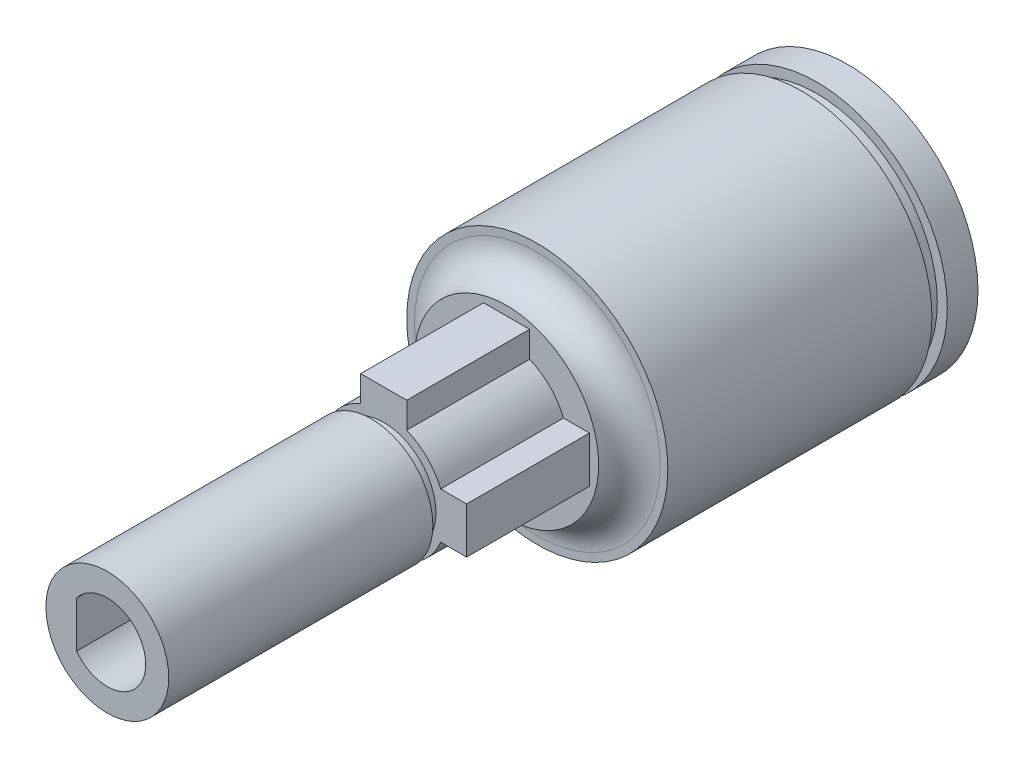
from build123d import *

# Parameters (mm, degrees)
EXTRUDE_1_DEPTH      = 25
EXTRUDE_1_DEPTH_BACK = 1
SKETCH_1_R           = 4
EXTRUDE_2_DEPTH      = 7
EXTRUDE_2_DEPTH_BACK = 1
SKETCH_2_R           = 2.5
EXTRUDE_3_DEPTH      = 2
EXTRUDE_START        = 2
SKETCH_2_3_R         = 6
SKETCH_2_3_R_2       = 2.5
EXTRUDE_4_DEPTH      = 2
SKETCH_4_W           = 0.8
SKETCH_4_H           = 0.6
SKETCH_5_R           = 8.5
EXTRUDE_5_DEPTH      = 20.2
SKETCH_6_W           = 1
SKETCH_6_H           = 0.65
FILLET_2_R           = 2


with BuildPart() as part:
    # 草图1 → 凸台-拉伸1 (new, two sides: drawn at the far end of the back side and taken through both)
    with BuildSketch(Plane.XY.offset(-EXTRUDE_1_DEPTH_BACK)):
        Circle(SKETCH_1_R)
        with BuildLine():
            Line((-2, -1.5), (-2, 1.5))
            ThreePointArc((-2, 1.5), (2.5, 0), (-2, -1.5))
        make_face(mode=Mode.SUBTRACT)
    extrude(amount=EXTRUDE_1_DEPTH + EXTRUDE_1_DEPTH_BACK)

    # 草图1<3> → 凸台-拉伸2 (add, two sides: drawn at the far end of the back side and taken through both)
    with BuildSketch(Plane.XY.offset(-EXTRUDE_2_DEPTH_BACK)):
        with BuildLine():
            Line((-1.5, 5.4), (-1.5, 3.708099244))
            ThreePointArc((-1.5, 3.708099244), (0, 4), (1.5, 3.708099244))
            Line((1.5, 3.708099244), (1.5, 5.4))
            Line((1.5, 5.4), (-1.5, 5.4))
        make_face()
        with BuildLine():
            Line((5.4, 1.5), (3.708099244, 1.5))
            ThreePointArc((3.708099244, 1.5), (4, 0), (3.708099244, -1.5))
            Line((3.708099244, -1.5), (5.4, -1.5))
            Line((5.4, -1.5), (5.4, 1.5))
        make_face()
    extrude(amount=EXTRUDE_2_DEPTH + EXTRUDE_2_DEPTH_BACK)

    # 草图2 → 凸台-拉伸3 (add)
    with BuildSketch(Plane(origin=(0, 0, -1), x_dir=(-1, 0, 0), z_dir=(0, 0, -1))):
        Circle(SKETCH_2_R)
    extrude(amount=-EXTRUDE_3_DEPTH)

    # 草图2<3> → 凸台-拉伸4 (add)
    # profile 1 of 2: a face of its own
    with BuildSketch(Plane(origin=(0, 0, -1), x_dir=(-1, 0, 0), z_dir=(0, 0, -1)).offset(EXTRUDE_START)):
        Circle(SKETCH_2_3_R)
        Circle(SKETCH_2_3_R_2, mode=Mode.SUBTRACT)
    # profile 2 of 2: a face of its own
    with BuildSketch(Plane(origin=(0, 0, -1), x_dir=(-1, 0, 0), z_dir=(0, 0, -1)).offset(EXTRUDE_START)):
        Circle(SKETCH_2_3_R_2)
    extrude(amount=-EXTRUDE_4_DEPTH)

    # 草图4 → 切除-旋转3 (revolve, cut)
    with BuildSketch(Plane(origin=(0, 0, 0), x_dir=(0, 0, -1), z_dir=(1, 0, 0)), mode=Mode.PRIVATE) as cut_revolve_3_sk:
        with Locations((-7.4, 3.7)):
            Rectangle(SKETCH_4_W, SKETCH_4_H)
    revolve(cut_revolve_3_sk.sketch.rotate(Axis((0, 0, 0), (0, 0, 1)), 90), axis=Axis((0, 0, 0), (0, 0, 1)), mode=Mode.SUBTRACT)

    # 草图5 → 凸台-拉伸5 (add)
    with BuildSketch(Plane(origin=(0, 0, -3), x_dir=(-1, 0, 0), z_dir=(0, 0, -1))):
        Circle(SKETCH_5_R)
    extrude(amount=EXTRUDE_5_DEPTH)

    # 草图6 → 切除-旋转4 (revolve, cut)
    with BuildSketch(Plane(origin=(0, 0, 0), x_dir=(0, 0, -1), z_dir=(1, 0, 0)), mode=Mode.PRIVATE) as cut_revolve_4_sk:
        with Locations((20.7, 8.175)):
            Rectangle(SKETCH_6_W, SKETCH_6_H)
    revolve(cut_revolve_4_sk.sketch.rotate(Axis((0, 0, 0), (0, 0, -1)), 90), axis=Axis((0, 0, 0), (0, 0, -1)), mode=Mode.SUBTRACT)

    # 圆角2
    fillet_2_edges = [part.edges().sort_by_distance(p)[0] for p in [
        (6, 0, -3),
    ]]
    fillet(fillet_2_edges, radius=FILLET_2_R - 0.0001)  # a hair under: the kernel refuses the full size


solid = part.part
